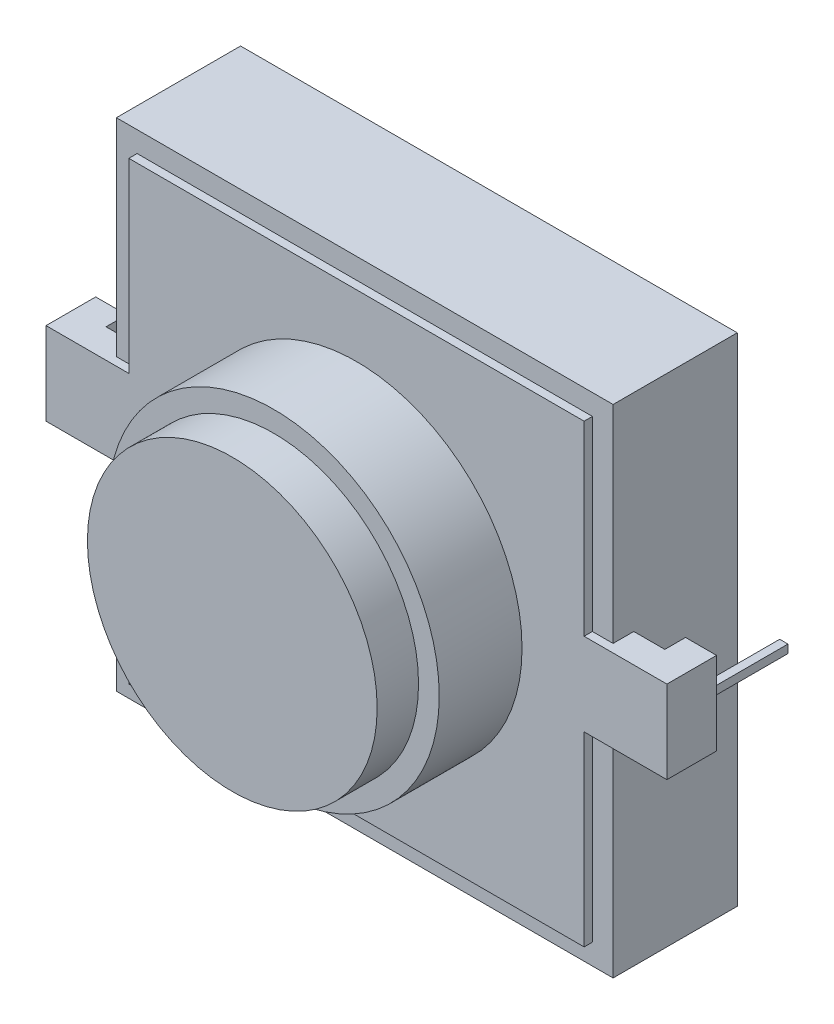
from build123d import *

# Parameters (mm, degrees)
ESQUISSE1_W             = 12
ESQUISSE1_H             = 12
BOSS_EXTRU_1_DEPTH      = 3
BOSS_EXTRU_2_DEPTH      = 0.2
BOSS_EXTRU_3_DEPTH      = 1
ESQUISSE4_W             = 0.2
ESQUISSE4_H             = 2
BOSS_EXTRU_4_DEPTH      = 0.1
ESQUISSE5_R             = 4
BOSS_EXTRU_5_DEPTH      = 2
ESQUISSE6_R             = 3.5
ENL_V_MAT_EXTRU_1_DEPTH = 2
BOSS_EXTRU_6_START      = 3
ESQUISSE7_R             = 3.5
BOSS_EXTRU_6_DEPTH      = 3


with BuildPart() as part:
    # Esquisse1 → Boss.-Extru.1 (new body)
    with BuildSketch(Plane.XY):
        Rectangle(ESQUISSE1_W, ESQUISSE1_H)
    extrude(amount=BOSS_EXTRU_1_DEPTH)

    # Esquisse2 → Boss.-Extru.2 (add)
    with BuildSketch(Plane.XY.offset(3)):
        Polygon((-5.5, 1), (-5.5, 5.5), (5.5, 5.5), (5.5, 1), (7.5, 1), (7.5, -1), (5.5, -1), (5.5, -5.5), (-5.5, -5.5), (-5.5, -1), (-7.5, -1), (-7.5, 1), align=None)
    extrude(amount=BOSS_EXTRU_2_DEPTH)

    # Esquisse3 → Boss.-Extru.3 (add, symmetric)
    with BuildSketch(Plane(origin=(0, 0, 0), x_dir=(1, 0, 0), z_dir=(0, 1, 0))):
        Polygon((6, -3), (6, -2.5), (6.75, -2.5), (6.75, -2), (7.5, -2), (7.5, -3), align=None)
        Polygon((-7.5, -3), (-6, -3), (-6, -2.5), (-6.75, -2.5), (-6.75, -2), (-7.5, -2), align=None)
    extrude(amount=BOSS_EXTRU_3_DEPTH, both=True)

    # Esquisse4 → Boss.-Extru.4 (add, symmetric)
    with BuildSketch(Plane(origin=(0, 0, 0), x_dir=(1, 0, 0), z_dir=(0, 1, 0))):
        with Locations((7.125, -1)):
            Rectangle(ESQUISSE4_W, ESQUISSE4_H)
        with Locations((-7.125, -1)):
            Rectangle(ESQUISSE4_W, ESQUISSE4_H)
    extrude(amount=BOSS_EXTRU_4_DEPTH, both=True)

    # Esquisse5 → Boss.-Extru.5 (add)
    with BuildSketch(Plane.XY.offset(3.2)):
        Circle(ESQUISSE5_R)
    extrude(amount=BOSS_EXTRU_5_DEPTH)

    # Esquisse6 → Enlèv. mat.-Extru.1 (cut)
    with BuildSketch(Plane.XY.offset(5.2)):
        Circle(ESQUISSE6_R)
    extrude(amount=-ENL_V_MAT_EXTRU_1_DEPTH, mode=Mode.SUBTRACT)

    # Esquisse7 → Boss.-Extru.6 (add)
    with BuildSketch(Plane.XY.offset(3.2).offset(BOSS_EXTRU_6_START)):
        Circle(ESQUISSE7_R)
    extrude(amount=-BOSS_EXTRU_6_DEPTH)


solid = part.part
